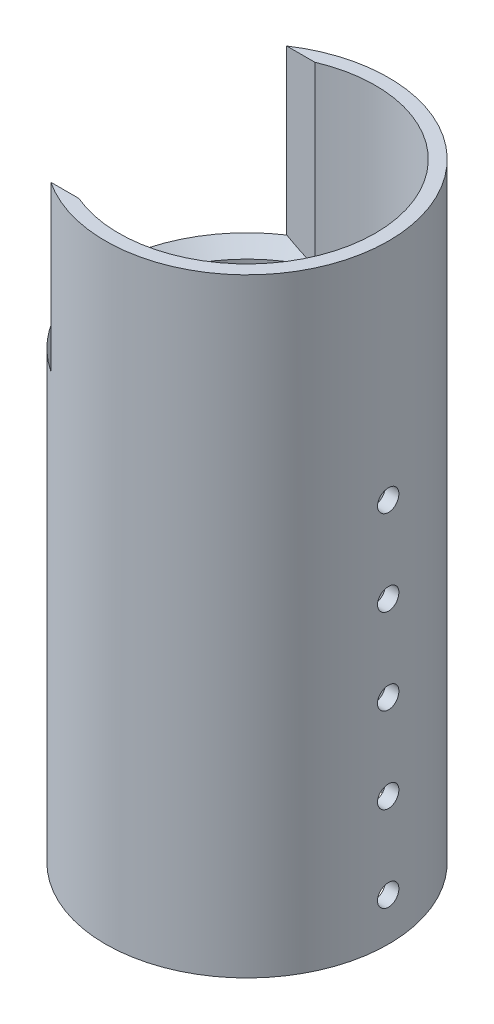
from build123d import *

# Parameters (mm, degrees)
SKETCH1_R           = 84.1375
SKETCH1_R_2         = 76.2
BOSS_EXTRUDE1_DEPTH = 180.975
CUT_EXTRUDE1_DEPTH  = 95.25
CUT_EXTRUDE2_START  = -95.25
CUT_EXTRUDE2_DEPTH  = 95.25
CHAMFER2_SIZE       = 10
SKETCH7_R           = 6.35
CUT_EXTRUDE9_DEPTH  = 95.25


with BuildPart() as part:
    # Sketch1 → Boss-Extrude1 (new, symmetric)
    with BuildSketch(Plane(origin=(0, 0, 0), x_dir=(1, 0, 0), z_dir=(0, 1, 0))):
        with Locations(Location((0, 0, 0), (0, 0, 270))):
            Circle(SKETCH1_R)
        with Locations(Location((0, 0, 0), (0, 0, 270))):
            Circle(SKETCH1_R_2, mode=Mode.SUBTRACT)
    extrude(amount=BOSS_EXTRUDE1_DEPTH, both=True)

    # Sketch2 → Cut-Extrude1 (cut)
    with BuildSketch(Plane(origin=(0, 180.975, 0), x_dir=(1, 0, 0), z_dir=(0, 1, 0))):
        with BuildLine():
            Line((0, 0), (-42.123694676, 63.498301921))
            Line((-42.123694676, 63.498301921), (-46.505926486, 70.116458181))
            ThreePointArc((-46.505926486, 70.116458181), (-84.1375, 0), (-46.505926486, -70.116458181))
            Line((-46.505926486, -70.116458181), (-42.118574931, -63.501697976))
            Line((-42.118574931, -63.501697976), (0, 0))
        make_face()
    extrude(amount=-CUT_EXTRUDE1_DEPTH, mode=Mode.SUBTRACT)

    # Sketch3 → Cut-Extrude2 (cut)
    with BuildSketch(Plane(origin=(0, 180.975, 0), x_dir=(1, 0, 0), z_dir=(0, 1, 0)).offset(CUT_EXTRUDE2_START)):
        with BuildLine():
            Line((-46.505926486, -70.116458181), (-29.83491733, -70.116458181))
            ThreePointArc((-29.83491733, -70.116458181), (-36.128451742, -67.090796498), (-42.118574931, -63.501697976))
            Line((-42.118574931, -63.501697976), (-46.505926486, -70.116458181))
        make_face()
        with BuildLine():
            Line((-46.505926486, 70.116458181), (-29.83491733, 70.116458181))
            ThreePointArc((-29.83491733, 70.116458181), (-36.131156341, 67.089339999), (-42.123694676, 63.498301921))
            Line((-42.123694676, 63.498301921), (-46.505926486, 70.116458181))
        make_face()
    extrude(amount=CUT_EXTRUDE2_DEPTH, mode=Mode.SUBTRACT)

    # Chamfer2
    # the kernel refuses this chamfer: 10 mm, written as the material it takes off along each edge
    with BuildSketch(Plane(origin=(0, 85.725, 0), x_dir=(-0.0644623510736034, 0, 0.9979201397376763), z_dir=(0.9979201397376763, 0, 0.0644623510736034))) as chamfer2_piece_1_section:
        Polygon((76.2, CHAMFER2_SIZE), (76.2 + CHAMFER2_SIZE, 0), (76.2, 0), align=None)
    chamfer2_piece_1 = revolve(axis=Axis((0, 85.725, 0), (0, -1, 0)), revolution_arc=172.608033228, mode=Mode.PRIVATE)
    chamfer2_piece_1 = split(chamfer2_piece_1, bisect_by=Plane(origin=(-81.050363846, 80.874636154, 70.116458181), z_dir=(0, 0, -1)), keep=Keep.TOP, mode=Mode.PRIVATE)
    chamfer2_piece_1 = split(chamfer2_piece_1, bisect_by=Plane(origin=(-81.050363846, 80.874636154, -70.116458181), z_dir=(0, 0, 1)), keep=Keep.TOP, mode=Mode.PRIVATE)
    add(chamfer2_piece_1, mode=Mode.SUBTRACT)

    # Sketch7 → Cut-Extrude9 (cut)
    with BuildSketch(Plane(origin=(0, 0, 0), x_dir=(0, 0, -1), z_dir=(1, 0, 0))):
        with Locations(Location((0, 47.625, 0), (0, 0, 180))):
            Circle(SKETCH7_R)
        with Locations(Location((0, -3.175, 0), (0, 0, 180))):
            Circle(SKETCH7_R)
        with Locations(Location((0, -53.975, 0), (0, 0, 180))):
            Circle(SKETCH7_R)
        with Locations(Location((0, -104.775, 0), (0, 0, 180))):
            Circle(SKETCH7_R)
        with Locations(Location((0, -155.575, 0), (0, 0, 180))):
            Circle(SKETCH7_R)
    extrude(amount=CUT_EXTRUDE9_DEPTH, mode=Mode.SUBTRACT)


solid = part.part
